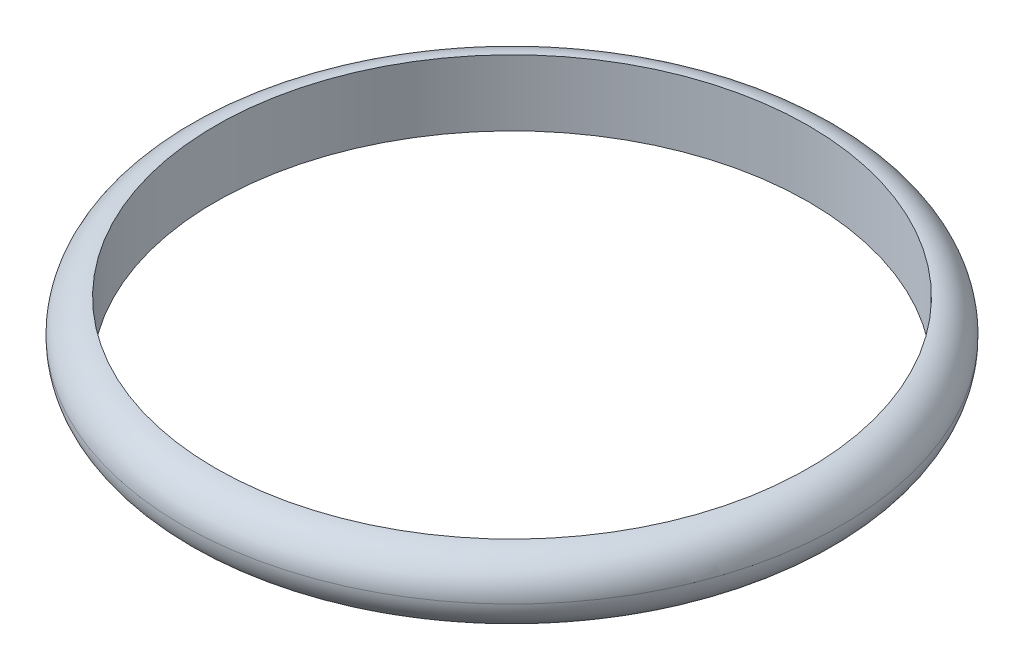
from build123d import *

# Parameters (mm, degrees)
ESQUISSE1_R      = 20
ESQUISSE1_R_2    = 18
EXTRUSION1_DEPTH = 4
CONG_1_R         = 2


with BuildPart() as part:
    # Esquisse1 → Extrusion1 (new body)
    with BuildSketch(Plane(origin=(0, 0, 0), x_dir=(1, 0, 0), z_dir=(0, 1, 0))):
        with Locations(Location((0, 0, 0), (0, 0, 270))):
            Circle(ESQUISSE1_R)
        with Locations(Location((0, 0, 0), (0, 0, 270))):
            Circle(ESQUISSE1_R_2, mode=Mode.SUBTRACT)
    extrude(amount=EXTRUSION1_DEPTH)

    # Congé1
    cong_1_edges = [part.edges().sort_by_distance(p)[0] for p in [
        (0, 0, -20),
        (0, 4, -20),
    ]]
    fillet(cong_1_edges, radius=CONG_1_R - 0.0001)  # a hair under: the kernel refuses the full size


solid = part.part
